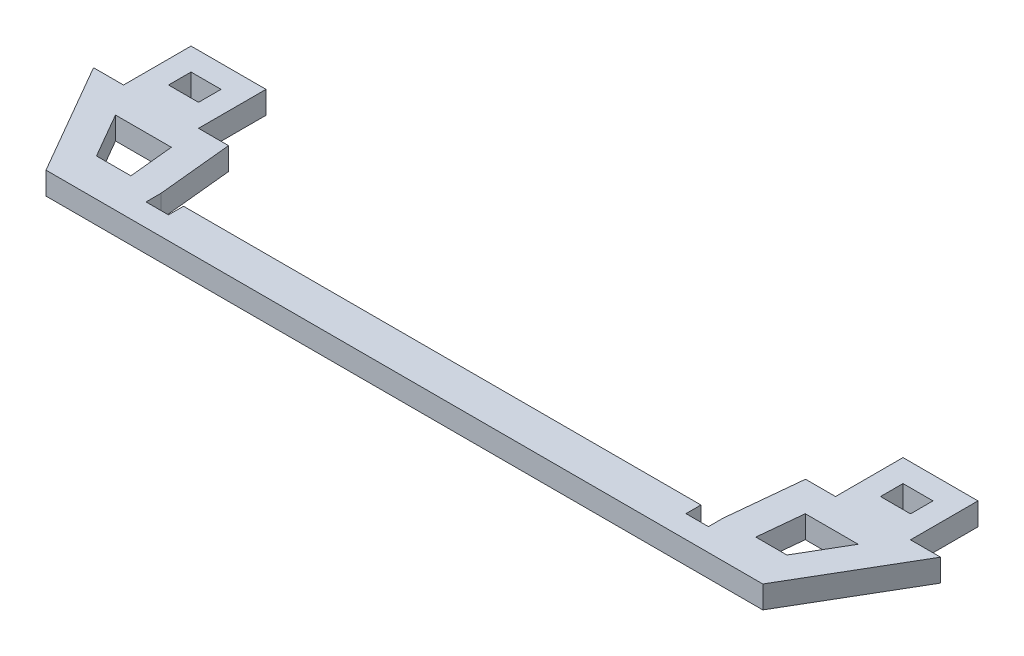
from build123d import *

# Parameters (mm, degrees)
SKETCH1_W           = 4
SKETCH1_H           = 3
BOSS_EXTRUDE1_DEPTH = 3


with BuildPart() as part:
    # Sketch1 → Boss-Extrude1 (new body)
    with BuildSketch(Plane(origin=(0, 0, 0), x_dir=(1, 0, 0), z_dir=(0, 1, 0))):
        Polygon((-62.418566214, -47.1586621), (-58.418566214, -47.1586621), (-58.418566214, -38.1586621), (-48.418566214, -38.1586621), (-48.418566214, -47.1586621), (-44.418566214, -47.1586621), (-43.418817081, -57.156153425), (-43.418817081, -59.1586621), (-40.418817081, -59.1586621), (-40.418817081, -57.1586621), (28.581433786, -57.1586621), (28.581433786, -59.1586621), (31.581433786, -59.1586621), (31.581433786, -57.208800497), (32.581433786, -47.211334262), (36.581433786, -47.211334262), (36.581433786, -38.211334262), (46.581433786, -38.211334262), (46.581433786, -47.211334262), (50.581433786, -47.211334262), (41.830582941, -62.1586621), (-53.758312176, -62.1586621), align=None)
        Polygon((36.547763078, -51.211334262), (43.604572315, -51.211334262), (40.093380681, -57.208800497), (35.947864455, -57.208800497), align=None, mode=Mode.SUBTRACT)
        with Locations((-53.418566214, -42.6586621)):
            Rectangle(SKETCH1_W, SKETCH1_H, mode=Mode.SUBTRACT)
        with Locations((41.581433786, -42.711334262)):
            Rectangle(SKETCH1_W, SKETCH1_H, mode=Mode.SUBTRACT)
        Polygon((-55.490362984, -51.1586621), (-48.038516462, -51.1586621), (-47.438516462, -57.1586621), (-52.026261368, -57.1586621), align=None, mode=Mode.SUBTRACT)
    extrude(amount=BOSS_EXTRUDE1_DEPTH)


solid = part.part
